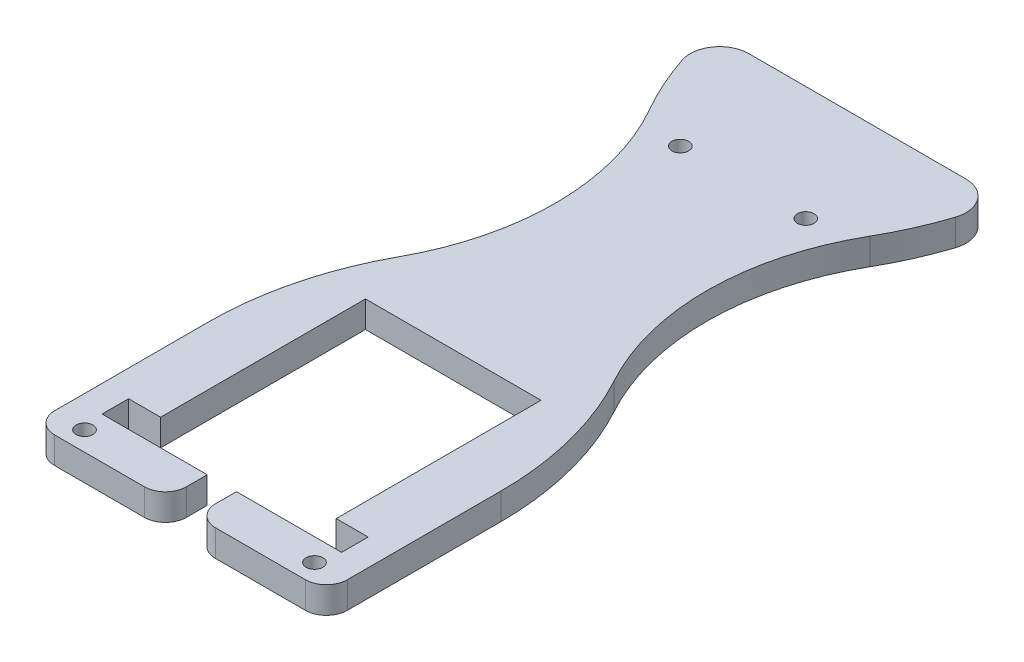
from build123d import *

# Parameters (mm, degrees)
BOSS_EXTRUDE1_DEPTH = 3.175
CUT_EXTRUDE1_DEPTH  = 204.138678001
SKETCH3_W           = 42
SKETCH3_H           = 55.35
SKETCH3_W_2         = 7
SKETCH3_H_2         = 10
SKETCH3_W_3         = 7.65
SKETCH3_H_3         = 6.35
CUT_EXTRUDE2_DEPTH  = 204.138678001
FILLET3_R           = 5
SKETCH4_R           = 2
CUT_EXTRUDE3_DEPTH  = 204.138678001
CUT_EXTRUDE4_DEPTH  = 204.138678001
FILLET4_R           = 76
FILLET5_R           = 7


with BuildPart() as part:
    # Sketch1 → Boss-Extrude1 (new, symmetric)
    with BuildSketch(Plane(origin=(0, 0, 0), x_dir=(1, 0, 0), z_dir=(0, 1, 0))):
        with BuildLine():
            Line((35, -200), (35, 0))
            ThreePointArc((35, 0), (0, 35), (-35, 0))
            Line((-35, 0), (-35, -200))
            Line((-35, -200), (35, -200))
        make_face()
    extrude(amount=BOSS_EXTRUDE1_DEPTH, both=True)

    # Sketch2 → Cut-Extrude1 (cut, through all)
    with BuildSketch(Plane(origin=(0, 3.175, 0), x_dir=(1, 0, 0), z_dir=(0, 1, 0))):
        with BuildLine():
            Line((-35, -38), (35, -38))
            Line((35, -38), (35, 0))
            ThreePointArc((35, 0), (0, 35), (-35, 0))
            Line((-35, 0), (-35, -38))
        make_face()
    extrude(amount=-CUT_EXTRUDE1_DEPTH, mode=Mode.SUBTRACT)

    # Sketch3 → Cut-Extrude2 (cut, through all)
    with BuildSketch(Plane(origin=(0, 3.175, 0), x_dir=(1, 0, 0), z_dir=(0, 1, 0))):
        with Locations((0, -162.325)):
            Rectangle(SKETCH3_W, SKETCH3_H)
        with Locations((0, -195)):
            Rectangle(SKETCH3_W_2, SKETCH3_H_2)
        with Locations((-24.825, -186.825)):
            Rectangle(SKETCH3_W_3, SKETCH3_H_3)
        with Locations((24.825, -186.825)):
            Rectangle(SKETCH3_W_3, SKETCH3_H_3)
    extrude(amount=-CUT_EXTRUDE2_DEPTH, mode=Mode.SUBTRACT)

    # Fillet3
    fillet3_edges = [part.edges().sort_by_distance(p)[0] for p in [
        (3.5, 0, 200),
        (-3.5, 0, 200),
        (35, 0, 200),
        (-35, 0, 200),
    ]]
    fillet(fillet3_edges, radius=FILLET3_R)

    # Sketch4 → Cut-Extrude3 (cut, through all)
    with BuildSketch(Plane(origin=(0, 3.175, 0), x_dir=(1, 0, 0), z_dir=(0, 1, 0))):
        with Locations(Location((15, -65.35, 0), (0, 0, 270))):
            Circle(SKETCH4_R)
        with Locations(Location((-15, -65.35, 0), (0, 0, 270))):
            Circle(SKETCH4_R)
        with Locations(Location((27.5, -195.35, 0), (0, 0, 270))):
            Circle(SKETCH4_R)
        with Locations(Location((-27.5, -195.35, 0), (0, 0, 270))):
            Circle(SKETCH4_R)
    extrude(amount=-CUT_EXTRUDE3_DEPTH, mode=Mode.SUBTRACT)

    # Sketch5 → Cut-Extrude4 (cut, through all)
    with BuildSketch(Plane(origin=(0, 3.175, 0), x_dir=(1, 0, 0), z_dir=(0, 1, 0))):
        with BuildLine():
            Line((-35, -134.65), (-35, -49.65))
            ThreePointArc((-35, -49.65), (-18.102907984, -92.15), (-35, -134.65))
        make_face()
    cut_extrude4 = extrude(amount=-CUT_EXTRUDE4_DEPTH, mode=Mode.SUBTRACT)

    # Mirror1: Cut-Extrude4 across plane
    add(cut_extrude4.mirror(Plane(origin=(0, 0, 0), x_dir=(0, 0, 1), z_dir=(1, 0, 0))), mode=Mode.SUBTRACT)

    # Fillet4
    # the kernel refuses this fillet: 76 mm, written as the material it takes off along each edge
    with BuildSketch(Plane(origin=(-35, 39.601520625, 49.65), x_dir=(0, 0, -1), z_dir=(0, -1, 0))) as fillet4_piece_1:
        with BuildLine():
            CenterArc((26.124451555, 74.608915367), FILLET4_R, 240.155370723, 18.865389254)
            Line((-11.696928446, 8.688181035), (-12.453356046, 7.369766348))
            ThreePointArc((-12.453356046, 7.369766348), (-6.498269887, 3.469254885), (-1.04366777, -1.105059992))
            Line((-1.04366777, -1.105059992), (0, -1.52))
            ThreePointArc((0, -1.52), (5.825, -1.52), (11.360510969, -1.492178307))
            Line((11.360510969, -1.492178307), (11.65, 0))
        make_face()
    extrude(amount=79.20304125, mode=Mode.SUBTRACT)
    with BuildSketch(Plane(origin=(-35, 62.277048415, 134.65), x_dir=(0.587963491001448, 0, -0.8088874663693276), z_dir=(0, -1, 0))) as fillet4_piece_2:
        with BuildLine():
            CenterArc((25.562462836, 75.375386129), FILLET4_R, 233.987375861, 28.66182532)
            Line((-19.12276248, 13.899938684), (-20.016466986, 12.670429736))
            Line((-20.016466986, 12.670429736), (-0.893704506, -1.229508949))
            Line((-0.893704506, -1.229508949), (0.194474848, -1.507507723))
            ThreePointArc((0.194474848, -1.507507723), (7.919360226, -1.011292338), (15.644245604, -1.507507723))
            Line((15.644245604, -1.507507723), (15.838720451, 0))
        make_face()
    extrude(amount=124.554096829, mode=Mode.SUBTRACT)
    with BuildSketch(Plane(origin=(35, 62.277048415, 134.65), x_dir=(-0.587963491001448, 0, -0.8088874663693276), z_dir=(0, -1, 0))) as fillet4_piece_3:
        with BuildLine():
            CenterArc((25.562462836, -75.375386129), FILLET4_R, 97.350798819, 28.66182532)
            Line((-19.12276248, -13.899938684), (-20.016466986, -12.670429736))
            Line((-20.016466986, -12.670429736), (-0.893704506, 1.229508949))
            Line((-0.893704506, 1.229508949), (0.194474848, 1.507507723))
            ThreePointArc((0.194474848, 1.507507723), (7.919360226, 1.011292338), (15.644245604, 1.507507723))
            Line((15.644245604, 1.507507723), (15.838720451, 0))
        make_face()
    extrude(amount=124.554096829, mode=Mode.SUBTRACT)
    with BuildSketch(Plane(origin=(35, 39.601520625, 49.65), x_dir=(0, 0, -1), z_dir=(0, -1, 0))) as fillet4_piece_4:
        with BuildLine():
            CenterArc((26.124451555, -74.608915367), FILLET4_R, 100.979240023, 18.865389254)
            Line((-11.696928446, -8.688181035), (-12.453356046, -7.369766348))
            ThreePointArc((-12.453356046, -7.369766348), (-6.498269887, -3.469254885), (-1.04366777, 1.105059992))
            Line((-1.04366777, 1.105059992), (0, 1.52))
            ThreePointArc((0, 1.52), (5.825, 1.52), (11.360510969, 1.492178307))
            Line((11.360510969, 1.492178307), (11.65, 0))
        make_face()
    extrude(amount=79.20304125, mode=Mode.SUBTRACT)

    # Fillet5
    fillet5_edges = [part.edges().sort_by_distance(p)[0] for p in [
        (35, 0, 38),
        (-35, 0, 38),
    ]]
    fillet(fillet5_edges, radius=FILLET5_R)


solid = part.part
